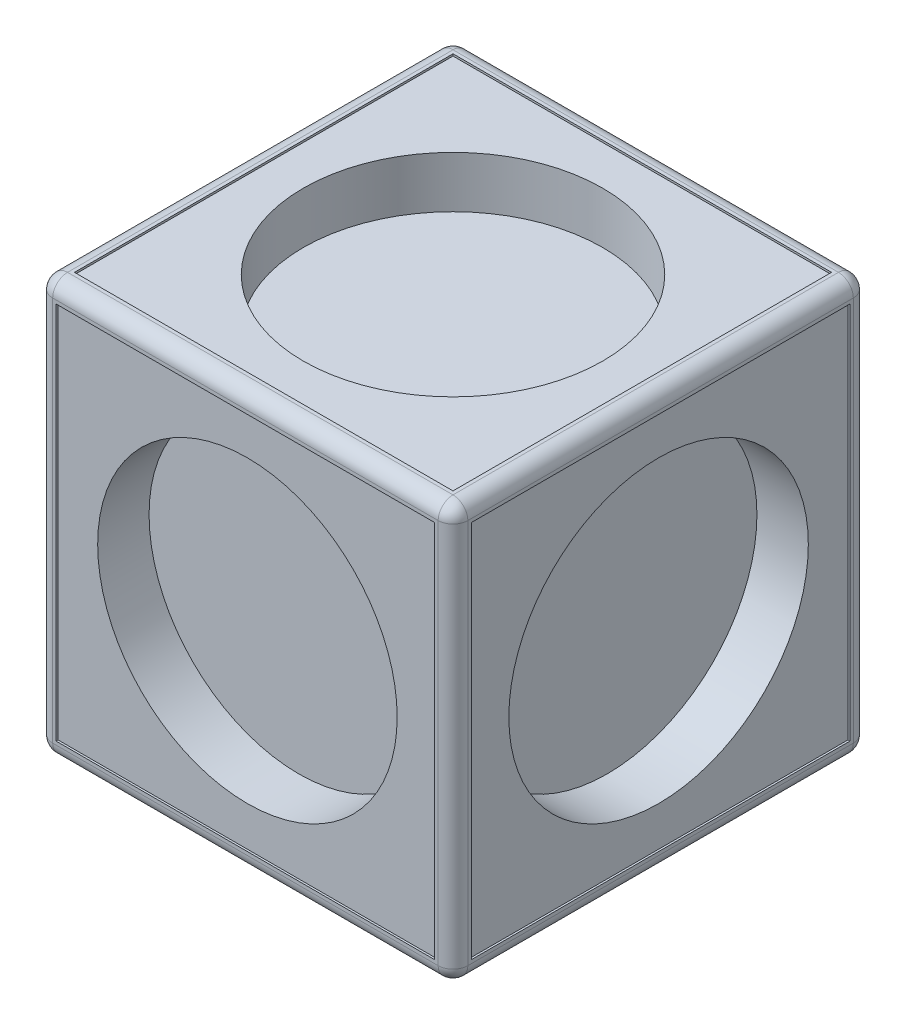
from build123d import *

# Parameters (mm, degrees)
SKETCH2_W           = 42
SKETCH2_H           = 42
BOSS_EXTRUDE1_DEPTH = 42
SKETCH3_R           = 15.15
CUT_EXTRUDE2_DEPTH  = 5.4
SKETCH4_W           = 38.3
SKETCH4_H           = 38.3
CUT_EXTRUDE3_DEPTH  = 0.2
SKETCH5_R           = 15.15
CUT_EXTRUDE4_DEPTH  = 5.4
SKETCH6_W           = 38.3
SKETCH6_H           = 38.3
CUT_EXTRUDE5_DEPTH  = 0.2
SKETCH7_R           = 15.15
CUT_EXTRUDE6_DEPTH  = 5.4
SKETCH8_W           = 38.3
SKETCH8_H           = 38.3
CUT_EXTRUDE7_DEPTH  = 0.2
FILLET1_R           = 1.5


with BuildPart() as part:
    # Sketch2 → Boss-Extrude1 (new body)
    with BuildSketch(Plane.XY):
        Rectangle(SKETCH2_W, SKETCH2_H)
    extrude(amount=BOSS_EXTRUDE1_DEPTH)

    # Sketch3 → Cut-Extrude2 (cut)
    with BuildSketch(Plane(origin=(0, 21, 0), x_dir=(1, 0, 0), z_dir=(0, 1, 0))):
        with Locations((0, -21)):
            Circle(SKETCH3_R)
    cut_extrude2 = extrude(amount=-CUT_EXTRUDE2_DEPTH, mode=Mode.SUBTRACT)

    # Sketch4 → Cut-Extrude3 (cut)
    with BuildSketch(Plane(origin=(0, 21, 0), x_dir=(1, 0, 0), z_dir=(0, 1, 0))):
        with Locations((0, -21)):
            Rectangle(SKETCH4_W, SKETCH4_H)
    cut_extrude3 = extrude(amount=-CUT_EXTRUDE3_DEPTH, mode=Mode.SUBTRACT)

    # Mirror1: Cut-Extrude2, Cut-Extrude3 across plane
    add(cut_extrude2.mirror(Plane.ZX), mode=Mode.SUBTRACT)
    add(cut_extrude3.mirror(Plane.ZX), mode=Mode.SUBTRACT)

    # Sketch5 → Cut-Extrude4 (cut)
    with BuildSketch(Plane(origin=(21, 0, 0), x_dir=(0, 0, -1), z_dir=(1, 0, 0))):
        with Locations((-21, 0)):
            Circle(SKETCH5_R)
    cut_extrude4 = extrude(amount=-CUT_EXTRUDE4_DEPTH, mode=Mode.SUBTRACT)

    # Sketch6 → Cut-Extrude5 (cut)
    with BuildSketch(Plane(origin=(21, 0, 0), x_dir=(0, 0, -1), z_dir=(1, 0, 0))):
        with Locations((-21, 0)):
            Rectangle(SKETCH6_W, SKETCH6_H)
    cut_extrude5 = extrude(amount=-CUT_EXTRUDE5_DEPTH, mode=Mode.SUBTRACT)

    # Sketch7 → Cut-Extrude6 (cut)
    with BuildSketch(Plane.XY.offset(42)):
        Circle(SKETCH7_R)
    cut_extrude6 = extrude(amount=-CUT_EXTRUDE6_DEPTH, mode=Mode.SUBTRACT)

    # Sketch8 → Cut-Extrude7 (cut)
    with BuildSketch(Plane.XY.offset(42)):
        Rectangle(SKETCH8_W, SKETCH8_H)
    cut_extrude7 = extrude(amount=-CUT_EXTRUDE7_DEPTH, mode=Mode.SUBTRACT)

    # Mirror2: Cut-Extrude4, Cut-Extrude5 across plane
    add(cut_extrude4.mirror(Plane(origin=(0, 0, 0), x_dir=(0, 0, 1), z_dir=(1, 0, 0))), mode=Mode.SUBTRACT)
    add(cut_extrude5.mirror(Plane(origin=(0, 0, 0), x_dir=(0, 0, 1), z_dir=(1, 0, 0))), mode=Mode.SUBTRACT)

    # Mirror3: Cut-Extrude6, Cut-Extrude7 across plane
    add(cut_extrude6.mirror(Plane(origin=(0, 0, 21), x_dir=(1, 0, 0), z_dir=(0, 0, -1))), mode=Mode.SUBTRACT)
    add(cut_extrude7.mirror(Plane(origin=(0, 0, 21), x_dir=(1, 0, 0), z_dir=(0, 0, -1))), mode=Mode.SUBTRACT)

    # Fillet1
    fillet1_edges = [part.edges().sort_by_distance(p)[0] for p in [
        (21, -21, 21),
        (0, -21, 0),
        (-21, -21, 21),
        (-21, 0, 42),
        (0, -21, 42),
        (0, 21, 42),
        (21, 0, 42),
        (21, 21, 21),
        (21, 0, 0),
        (-21, 0, 0),
        (0, 21, 0),
        (-21, 21, 21),
    ]]
    fillet(fillet1_edges, radius=FILLET1_R)


solid = part.part
